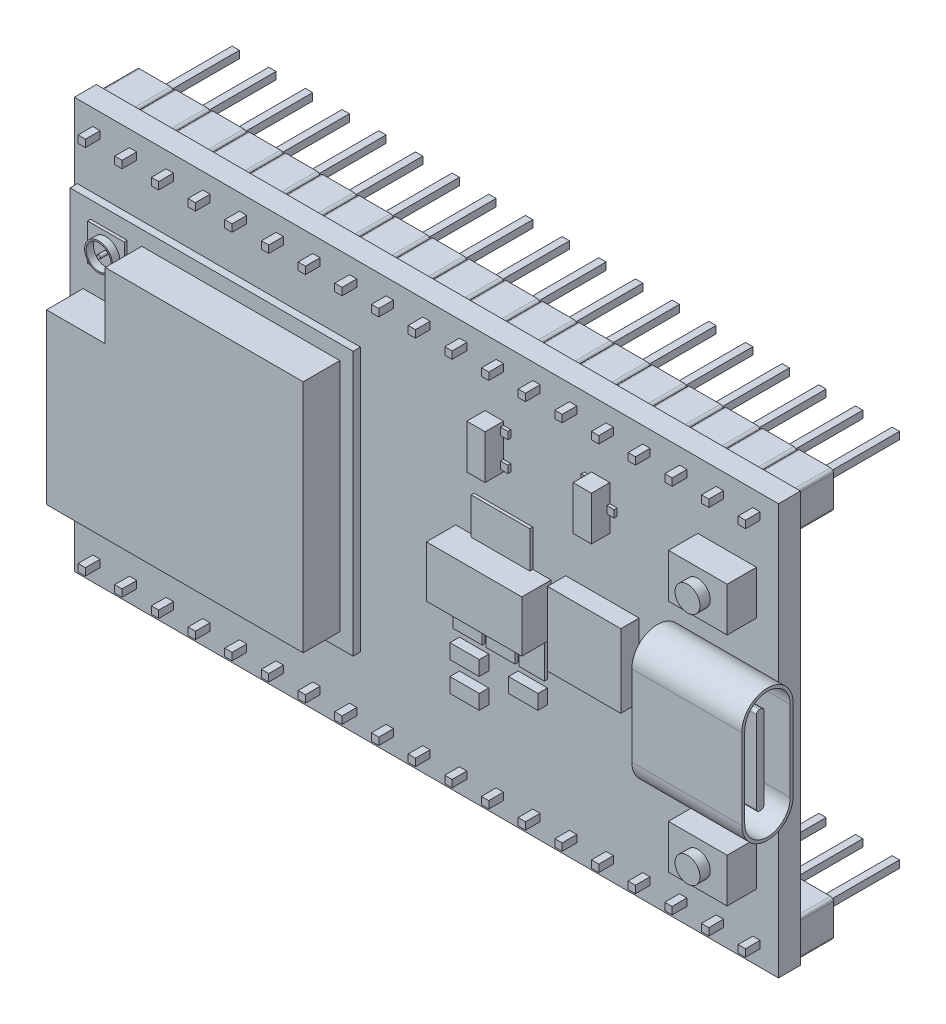
from build123d import *

# Parameters (mm, degrees)
SKETCH1_W                = 48
SKETCH1_H                = 28
BOSS_EXTRUDE1_DEPTH      = 1.5
BOSS_EXTRUDE2_DEPTH      = 2.5
BOSS_EXTRUDE3_DEPTH      = 5.5
BOSS_EXTRUDE3_DEPTH_BACK = 5
SKETCH3_W                = 0.5
SKETCH3_H                = 0.5
BOSS_EXTRUDE4_START      = -6
BOSS_EXTRUDE4_DEPTH      = 7
BOSS_EXTRUDE5_START      = 0.5
BOSS_EXTRUDE5_DEPTH      = 0.5
BOSS_EXTRUDE6_DEPTH      = 6.5
SKETCH7_W                = 19.3
SKETCH7_H                = 18
BOSS_EXTRUDE7_DEPTH      = 0.5
BOSS_EXTRUDE8_DEPTH      = 2.5
SKETCH9_W                = 2.5
SKETCH9_H                = 2.5
BOSS_EXTRUDE9_DEPTH      = 0.2
SKETCH10_R               = 0.95
SKETCH10_R_2             = 0.85
SKETCH10_R_3             = 0.125
BOSS_EXTRUDE10_DEPTH     = 0.5
SKETCH11_W               = 5
SKETCH11_H               = 5
SKETCH11_W_2             = 1.25
SKETCH11_H_2             = 3
BOSS_EXTRUDE11_DEPTH     = 1.25
SKETCH12_W               = 6.5
SKETCH12_H               = 3.5
BOSS_EXTRUDE12_DEPTH     = 2
SKETCH13_W               = 0.5
SKETCH13_H               = 0.5
SKETCH13_W_2             = 1.75
SKETCH13_H_2             = 2.5
SKETCH13_W_3             = 2
SKETCH13_W_4             = 4
BOSS_EXTRUDE13_DEPTH     = 0.2
SKETCH14_W               = 2
SKETCH14_H               = 1
BOSS_EXTRUDE14_DEPTH     = 0.65
SKETCH15_W               = 4
SKETCH15_H               = 3
BOSS_EXTRUDE15_DEPTH     = 2
SKETCH16_R               = 0.85
BOSS_EXTRUDE16_DEPTH     = 0.7


with BuildPart() as part:
    # Sketch1 → Boss-Extrude1 (new body)
    with BuildSketch(Plane.XY):
        Rectangle(SKETCH1_W, SKETCH1_H)
    extrude(amount=BOSS_EXTRUDE1_DEPTH)

    # Sketch2 → Boss-Extrude2 (add)
    with BuildSketch(Plane(origin=(0, 0, 0), x_dir=(-1, 0, 0), z_dir=(0, 0, -1))):
        with BuildLine():
            Line((-23.55, -13.9), (-21.45, -13.9))
            ThreePointArc((-21.45, -13.9), (-21.308578644, -13.841421356), (-21.25, -13.7))
            ThreePointArc((-21.25, -13.7), (-21.191421356, -13.841421356), (-21.05, -13.9))
            Line((-21.05, -13.9), (-18.95, -13.9))
            ThreePointArc((-18.95, -13.9), (-18.808578644, -13.841421356), (-18.75, -13.7))
            ThreePointArc((-18.75, -13.7), (-18.691421356, -13.841421356), (-18.55, -13.9))
            Line((-18.55, -13.9), (-16.45, -13.9))
            ThreePointArc((-16.45, -13.9), (-16.308578644, -13.841421356), (-16.25, -13.7))
            ThreePointArc((-16.25, -13.7), (-16.191421356, -13.841421356), (-16.05, -13.9))
            Line((-16.05, -13.9), (-13.95, -13.9))
            ThreePointArc((-13.95, -13.9), (-13.808578644, -13.841421356), (-13.75, -13.7))
            ThreePointArc((-13.75, -13.7), (-13.691421356, -13.841421356), (-13.55, -13.9))
            Line((-13.55, -13.9), (-11.45, -13.9))
            ThreePointArc((-11.45, -13.9), (-11.308578644, -13.841421356), (-11.25, -13.7))
            ThreePointArc((-11.25, -13.7), (-11.191421356, -13.841421356), (-11.05, -13.9))
            Line((-11.05, -13.9), (-8.95, -13.9))
            ThreePointArc((-8.95, -13.9), (-8.808578644, -13.841421356), (-8.75, -13.7))
            ThreePointArc((-8.75, -13.7), (-8.691421356, -13.841421356), (-8.55, -13.9))
            Line((-8.55, -13.9), (-6.45, -13.9))
            ThreePointArc((-6.45, -13.9), (-6.308578644, -13.841421356), (-6.25, -13.7))
            ThreePointArc((-6.25, -13.7), (-6.191421356, -13.841421356), (-6.05, -13.9))
            Line((-6.05, -13.9), (-3.95, -13.9))
            ThreePointArc((-3.95, -13.9), (-3.808578644, -13.841421356), (-3.75, -13.7))
            ThreePointArc((-3.75, -13.7), (-3.691421356, -13.841421356), (-3.55, -13.9))
            Line((-3.55, -13.9), (-1.45, -13.9))
            ThreePointArc((-1.45, -13.9), (-1.308578644, -13.841421356), (-1.25, -13.7))
            ThreePointArc((-1.25, -13.7), (-1.191421356, -13.841421356), (-1.05, -13.9))
            Line((-1.05, -13.9), (1.05, -13.9))
            ThreePointArc((1.05, -13.9), (1.191421356, -13.841421356), (1.25, -13.7))
            ThreePointArc((1.25, -13.7), (1.308578644, -13.841421356), (1.45, -13.9))
            Line((1.45, -13.9), (3.55, -13.9))
            ThreePointArc((3.55, -13.9), (3.691421356, -13.841421356), (3.75, -13.7))
            ThreePointArc((3.75, -13.7), (3.808578644, -13.841421356), (3.95, -13.9))
            Line((3.95, -13.9), (6.05, -13.9))
            ThreePointArc((6.05, -13.9), (6.191421356, -13.841421356), (6.25, -13.7))
            ThreePointArc((6.25, -13.7), (6.308578644, -13.841421356), (6.45, -13.9))
            Line((6.45, -13.9), (8.55, -13.9))
            ThreePointArc((8.55, -13.9), (8.691421356, -13.841421356), (8.75, -13.7))
            ThreePointArc((8.75, -13.7), (8.808578644, -13.841421356), (8.95, -13.9))
            Line((8.95, -13.9), (11.05, -13.9))
            ThreePointArc((11.05, -13.9), (11.191421356, -13.841421356), (11.25, -13.7))
            ThreePointArc((11.25, -13.7), (11.308578644, -13.841421356), (11.45, -13.9))
            Line((11.45, -13.9), (13.55, -13.9))
            ThreePointArc((13.55, -13.9), (13.691421356, -13.841421356), (13.75, -13.7))
            ThreePointArc((13.75, -13.7), (13.808578644, -13.841421356), (13.95, -13.9))
            Line((13.95, -13.9), (16.05, -13.9))
            ThreePointArc((16.05, -13.9), (16.191421356, -13.841421356), (16.25, -13.7))
            ThreePointArc((16.25, -13.7), (16.308578644, -13.841421356), (16.45, -13.9))
            Line((16.45, -13.9), (18.55, -13.9))
            ThreePointArc((18.55, -13.9), (18.691421356, -13.841421356), (18.75, -13.7))
            ThreePointArc((18.75, -13.7), (18.808578644, -13.841421356), (18.95, -13.9))
            Line((18.95, -13.9), (21.05, -13.9))
            ThreePointArc((21.05, -13.9), (21.191421356, -13.841421356), (21.25, -13.7))
            ThreePointArc((21.25, -13.7), (21.308578644, -13.841421356), (21.45, -13.9))
            Line((21.45, -13.9), (23.55, -13.9))
            ThreePointArc((23.55, -13.9), (23.691421356, -13.841421356), (23.75, -13.7))
            Line((23.75, -13.7), (23.75, -11.6))
            ThreePointArc((23.75, -11.6), (23.691421356, -11.458578644), (23.55, -11.4))
            Line((23.55, -11.4), (21.45, -11.4))
            ThreePointArc((21.45, -11.4), (21.308578644, -11.458578644), (21.25, -11.6))
            ThreePointArc((21.25, -11.6), (21.191421356, -11.458578644), (21.05, -11.4))
            Line((21.05, -11.4), (18.95, -11.4))
            ThreePointArc((18.95, -11.4), (18.808578644, -11.458578644), (18.75, -11.6))
            ThreePointArc((18.75, -11.6), (18.691421356, -11.458578644), (18.55, -11.4))
            Line((18.55, -11.4), (16.45, -11.4))
            ThreePointArc((16.45, -11.4), (16.308578644, -11.458578644), (16.25, -11.6))
            ThreePointArc((16.25, -11.6), (16.191421356, -11.458578644), (16.05, -11.4))
            Line((16.05, -11.4), (13.95, -11.4))
            ThreePointArc((13.95, -11.4), (13.808578644, -11.458578644), (13.75, -11.6))
            ThreePointArc((13.75, -11.6), (13.691421356, -11.458578644), (13.55, -11.4))
            Line((13.55, -11.4), (11.45, -11.4))
            ThreePointArc((11.45, -11.4), (11.308578644, -11.458578644), (11.25, -11.6))
            ThreePointArc((11.25, -11.6), (11.191421356, -11.458578644), (11.05, -11.4))
            Line((11.05, -11.4), (8.95, -11.4))
            ThreePointArc((8.95, -11.4), (8.808578644, -11.458578644), (8.75, -11.6))
            ThreePointArc((8.75, -11.6), (8.691421356, -11.458578644), (8.55, -11.4))
            Line((8.55, -11.4), (6.45, -11.4))
            ThreePointArc((6.45, -11.4), (6.308578644, -11.458578644), (6.25, -11.6))
            ThreePointArc((6.25, -11.6), (6.191421356, -11.458578644), (6.05, -11.4))
            Line((6.05, -11.4), (3.95, -11.4))
            ThreePointArc((3.95, -11.4), (3.808578644, -11.458578644), (3.75, -11.6))
            ThreePointArc((3.75, -11.6), (3.691421356, -11.458578644), (3.55, -11.4))
            Line((3.55, -11.4), (1.45, -11.4))
            ThreePointArc((1.45, -11.4), (1.308578644, -11.458578644), (1.25, -11.6))
            ThreePointArc((1.25, -11.6), (1.191421356, -11.458578644), (1.05, -11.4))
            Line((1.05, -11.4), (-1.05, -11.4))
            ThreePointArc((-1.05, -11.4), (-1.191421356, -11.458578644), (-1.25, -11.6))
            ThreePointArc((-1.25, -11.6), (-1.308578644, -11.458578644), (-1.45, -11.4))
            Line((-1.45, -11.4), (-3.55, -11.4))
            ThreePointArc((-3.55, -11.4), (-3.691421356, -11.458578644), (-3.75, -11.6))
            ThreePointArc((-3.75, -11.6), (-3.808578644, -11.458578644), (-3.95, -11.4))
            Line((-3.95, -11.4), (-6.05, -11.4))
            ThreePointArc((-6.05, -11.4), (-6.191421356, -11.458578644), (-6.25, -11.6))
            ThreePointArc((-6.25, -11.6), (-6.308578644, -11.458578644), (-6.45, -11.4))
            Line((-6.45, -11.4), (-8.55, -11.4))
            ThreePointArc((-8.55, -11.4), (-8.691421356, -11.458578644), (-8.75, -11.6))
            ThreePointArc((-8.75, -11.6), (-8.808578644, -11.458578644), (-8.95, -11.4))
            Line((-8.95, -11.4), (-11.05, -11.4))
            ThreePointArc((-11.05, -11.4), (-11.191421356, -11.458578644), (-11.25, -11.6))
            ThreePointArc((-11.25, -11.6), (-11.308578644, -11.458578644), (-11.45, -11.4))
            Line((-11.45, -11.4), (-13.55, -11.4))
            ThreePointArc((-13.55, -11.4), (-13.691421356, -11.458578644), (-13.75, -11.6))
            ThreePointArc((-13.75, -11.6), (-13.808578644, -11.458578644), (-13.95, -11.4))
            Line((-13.95, -11.4), (-16.05, -11.4))
            ThreePointArc((-16.05, -11.4), (-16.191421356, -11.458578644), (-16.25, -11.6))
            ThreePointArc((-16.25, -11.6), (-16.308578644, -11.458578644), (-16.45, -11.4))
            Line((-16.45, -11.4), (-18.55, -11.4))
            ThreePointArc((-18.55, -11.4), (-18.691421356, -11.458578644), (-18.75, -11.6))
            ThreePointArc((-18.75, -11.6), (-18.808578644, -11.458578644), (-18.95, -11.4))
            Line((-18.95, -11.4), (-21.05, -11.4))
            ThreePointArc((-21.05, -11.4), (-21.191421356, -11.458578644), (-21.25, -11.6))
            ThreePointArc((-21.25, -11.6), (-21.308578644, -11.458578644), (-21.45, -11.4))
            Line((-21.45, -11.4), (-23.55, -11.4))
            ThreePointArc((-23.55, -11.4), (-23.691421356, -11.458578644), (-23.75, -11.6))
            Line((-23.75, -11.6), (-23.75, -13.7))
            ThreePointArc((-23.75, -13.7), (-23.691421356, -13.841421356), (-23.55, -13.9))
        make_face()
        with BuildLine():
            Line((21.45, 11.4), (23.55, 11.4))
            ThreePointArc((23.55, 11.4), (23.691421356, 11.458578644), (23.75, 11.6))
            Line((23.75, 11.6), (23.75, 13.7))
            ThreePointArc((23.75, 13.7), (23.691421356, 13.841421356), (23.55, 13.9))
            Line((23.55, 13.9), (21.45, 13.9))
            ThreePointArc((21.45, 13.9), (21.308578644, 13.841421356), (21.25, 13.7))
            ThreePointArc((21.25, 13.7), (21.191421356, 13.841421356), (21.05, 13.9))
            Line((21.05, 13.9), (18.95, 13.9))
            ThreePointArc((18.95, 13.9), (18.808578644, 13.841421356), (18.75, 13.7))
            ThreePointArc((18.75, 13.7), (18.691421356, 13.841421356), (18.55, 13.9))
            Line((18.55, 13.9), (16.45, 13.9))
            ThreePointArc((16.45, 13.9), (16.308578644, 13.841421356), (16.25, 13.7))
            ThreePointArc((16.25, 13.7), (16.191421356, 13.841421356), (16.05, 13.9))
            Line((16.05, 13.9), (13.95, 13.9))
            ThreePointArc((13.95, 13.9), (13.808578644, 13.841421356), (13.75, 13.7))
            ThreePointArc((13.75, 13.7), (13.691421356, 13.841421356), (13.55, 13.9))
            Line((13.55, 13.9), (11.45, 13.9))
            ThreePointArc((11.45, 13.9), (11.308578644, 13.841421356), (11.25, 13.7))
            ThreePointArc((11.25, 13.7), (11.191421356, 13.841421356), (11.05, 13.9))
            Line((11.05, 13.9), (8.95, 13.9))
            ThreePointArc((8.95, 13.9), (8.808578644, 13.841421356), (8.75, 13.7))
            ThreePointArc((8.75, 13.7), (8.691421356, 13.841421356), (8.55, 13.9))
            Line((8.55, 13.9), (6.45, 13.9))
            ThreePointArc((6.45, 13.9), (6.308578644, 13.841421356), (6.25, 13.7))
            ThreePointArc((6.25, 13.7), (6.191421356, 13.841421356), (6.05, 13.9))
            Line((6.05, 13.9), (3.95, 13.9))
            ThreePointArc((3.95, 13.9), (3.808578644, 13.841421356), (3.75, 13.7))
            ThreePointArc((3.75, 13.7), (3.691421356, 13.841421356), (3.55, 13.9))
            Line((3.55, 13.9), (1.45, 13.9))
            ThreePointArc((1.45, 13.9), (1.308578644, 13.841421356), (1.25, 13.7))
            ThreePointArc((1.25, 13.7), (1.191421356, 13.841421356), (1.05, 13.9))
            Line((1.05, 13.9), (-1.05, 13.9))
            ThreePointArc((-1.05, 13.9), (-1.191421356, 13.841421356), (-1.25, 13.7))
            ThreePointArc((-1.25, 13.7), (-1.308578644, 13.841421356), (-1.45, 13.9))
            Line((-1.45, 13.9), (-3.55, 13.9))
            ThreePointArc((-3.55, 13.9), (-3.691421356, 13.841421356), (-3.75, 13.7))
            ThreePointArc((-3.75, 13.7), (-3.808578644, 13.841421356), (-3.95, 13.9))
            Line((-3.95, 13.9), (-6.05, 13.9))
            ThreePointArc((-6.05, 13.9), (-6.191421356, 13.841421356), (-6.25, 13.7))
            ThreePointArc((-6.25, 13.7), (-6.308578644, 13.841421356), (-6.45, 13.9))
            Line((-6.45, 13.9), (-8.55, 13.9))
            ThreePointArc((-8.55, 13.9), (-8.691421356, 13.841421356), (-8.75, 13.7))
            ThreePointArc((-8.75, 13.7), (-8.808578644, 13.841421356), (-8.95, 13.9))
            Line((-8.95, 13.9), (-11.05, 13.9))
            ThreePointArc((-11.05, 13.9), (-11.191421356, 13.841421356), (-11.25, 13.7))
            ThreePointArc((-11.25, 13.7), (-11.308578644, 13.841421356), (-11.45, 13.9))
            Line((-11.45, 13.9), (-13.55, 13.9))
            ThreePointArc((-13.55, 13.9), (-13.691421356, 13.841421356), (-13.75, 13.7))
            ThreePointArc((-13.75, 13.7), (-13.808578644, 13.841421356), (-13.95, 13.9))
            Line((-13.95, 13.9), (-16.05, 13.9))
            ThreePointArc((-16.05, 13.9), (-16.191421356, 13.841421356), (-16.25, 13.7))
            ThreePointArc((-16.25, 13.7), (-16.308578644, 13.841421356), (-16.45, 13.9))
            Line((-16.45, 13.9), (-18.55, 13.9))
            ThreePointArc((-18.55, 13.9), (-18.691421356, 13.841421356), (-18.75, 13.7))
            ThreePointArc((-18.75, 13.7), (-18.808578644, 13.841421356), (-18.95, 13.9))
            Line((-18.95, 13.9), (-21.05, 13.9))
            ThreePointArc((-21.05, 13.9), (-21.191421356, 13.841421356), (-21.25, 13.7))
            ThreePointArc((-21.25, 13.7), (-21.308578644, 13.841421356), (-21.45, 13.9))
            Line((-21.45, 13.9), (-23.55, 13.9))
            ThreePointArc((-23.55, 13.9), (-23.691421356, 13.841421356), (-23.75, 13.7))
            Line((-23.75, 13.7), (-23.75, 11.6))
            ThreePointArc((-23.75, 11.6), (-23.691421356, 11.458578644), (-23.55, 11.4))
            Line((-23.55, 11.4), (-21.45, 11.4))
            ThreePointArc((-21.45, 11.4), (-21.308578644, 11.458578644), (-21.25, 11.6))
            ThreePointArc((-21.25, 11.6), (-21.191421356, 11.458578644), (-21.05, 11.4))
            Line((-21.05, 11.4), (-18.95, 11.4))
            ThreePointArc((-18.95, 11.4), (-18.808578644, 11.458578644), (-18.75, 11.6))
            ThreePointArc((-18.75, 11.6), (-18.691421356, 11.458578644), (-18.55, 11.4))
            Line((-18.55, 11.4), (-16.45, 11.4))
            ThreePointArc((-16.45, 11.4), (-16.308578644, 11.458578644), (-16.25, 11.6))
            ThreePointArc((-16.25, 11.6), (-16.191421356, 11.458578644), (-16.05, 11.4))
            Line((-16.05, 11.4), (-13.95, 11.4))
            ThreePointArc((-13.95, 11.4), (-13.808578644, 11.458578644), (-13.75, 11.6))
            ThreePointArc((-13.75, 11.6), (-13.691421356, 11.458578644), (-13.55, 11.4))
            Line((-13.55, 11.4), (-11.45, 11.4))
            ThreePointArc((-11.45, 11.4), (-11.308578644, 11.458578644), (-11.25, 11.6))
            ThreePointArc((-11.25, 11.6), (-11.191421356, 11.458578644), (-11.05, 11.4))
            Line((-11.05, 11.4), (-8.95, 11.4))
            ThreePointArc((-8.95, 11.4), (-8.808578644, 11.458578644), (-8.75, 11.6))
            ThreePointArc((-8.75, 11.6), (-8.691421356, 11.458578644), (-8.55, 11.4))
            Line((-8.55, 11.4), (-6.45, 11.4))
            ThreePointArc((-6.45, 11.4), (-6.308578644, 11.458578644), (-6.25, 11.6))
            ThreePointArc((-6.25, 11.6), (-6.191421356, 11.458578644), (-6.05, 11.4))
            Line((-6.05, 11.4), (-3.95, 11.4))
            ThreePointArc((-3.95, 11.4), (-3.808578644, 11.458578644), (-3.75, 11.6))
            ThreePointArc((-3.75, 11.6), (-3.691421356, 11.458578644), (-3.55, 11.4))
            Line((-3.55, 11.4), (-1.45, 11.4))
            ThreePointArc((-1.45, 11.4), (-1.308578644, 11.458578644), (-1.25, 11.6))
            ThreePointArc((-1.25, 11.6), (-1.191421356, 11.458578644), (-1.05, 11.4))
            Line((-1.05, 11.4), (1.05, 11.4))
            ThreePointArc((1.05, 11.4), (1.191421356, 11.458578644), (1.25, 11.6))
            ThreePointArc((1.25, 11.6), (1.308578644, 11.458578644), (1.45, 11.4))
            Line((1.45, 11.4), (3.55, 11.4))
            ThreePointArc((3.55, 11.4), (3.691421356, 11.458578644), (3.75, 11.6))
            ThreePointArc((3.75, 11.6), (3.808578644, 11.458578644), (3.95, 11.4))
            Line((3.95, 11.4), (6.05, 11.4))
            ThreePointArc((6.05, 11.4), (6.191421356, 11.458578644), (6.25, 11.6))
            ThreePointArc((6.25, 11.6), (6.308578644, 11.458578644), (6.45, 11.4))
            Line((6.45, 11.4), (8.55, 11.4))
            ThreePointArc((8.55, 11.4), (8.691421356, 11.458578644), (8.75, 11.6))
            ThreePointArc((8.75, 11.6), (8.808578644, 11.458578644), (8.95, 11.4))
            Line((8.95, 11.4), (11.05, 11.4))
            ThreePointArc((11.05, 11.4), (11.191421356, 11.458578644), (11.25, 11.6))
            ThreePointArc((11.25, 11.6), (11.308578644, 11.458578644), (11.45, 11.4))
            Line((11.45, 11.4), (13.55, 11.4))
            ThreePointArc((13.55, 11.4), (13.691421356, 11.458578644), (13.75, 11.6))
            ThreePointArc((13.75, 11.6), (13.808578644, 11.458578644), (13.95, 11.4))
            Line((13.95, 11.4), (16.05, 11.4))
            ThreePointArc((16.05, 11.4), (16.191421356, 11.458578644), (16.25, 11.6))
            ThreePointArc((16.25, 11.6), (16.308578644, 11.458578644), (16.45, 11.4))
            Line((16.45, 11.4), (18.55, 11.4))
            ThreePointArc((18.55, 11.4), (18.691421356, 11.458578644), (18.75, 11.6))
            ThreePointArc((18.75, 11.6), (18.808578644, 11.458578644), (18.95, 11.4))
            Line((18.95, 11.4), (21.05, 11.4))
            ThreePointArc((21.05, 11.4), (21.191421356, 11.458578644), (21.25, 11.6))
            ThreePointArc((21.25, 11.6), (21.308578644, 11.458578644), (21.45, 11.4))
        make_face()
    extrude(amount=BOSS_EXTRUDE2_DEPTH)

    # Sketch3 → Boss-Extrude3 (add, two sides: drawn at the far end of the back side and taken through both)
    with BuildSketch(Plane(origin=(0, 0, -2.5), x_dir=(-1, 0, 0), z_dir=(0, 0, -1)).offset(-BOSS_EXTRUDE3_DEPTH_BACK)):
        with Locations((-22.5, -12.65)):
            Rectangle(SKETCH3_W, SKETCH3_H)
        with Locations((-20, -12.65)):
            Rectangle(SKETCH3_W, SKETCH3_H)
        with Locations((-17.5, -12.65)):
            Rectangle(SKETCH3_W, SKETCH3_H)
        with Locations((-15, -12.65)):
            Rectangle(SKETCH3_W, SKETCH3_H)
        with Locations((-12.5, -12.65)):
            Rectangle(SKETCH3_W, SKETCH3_H)
        with Locations((-10, -12.65)):
            Rectangle(SKETCH3_W, SKETCH3_H)
        with Locations((-7.5, -12.65)):
            Rectangle(SKETCH3_W, SKETCH3_H)
        with Locations((-5, -12.65)):
            Rectangle(SKETCH3_W, SKETCH3_H)
        with Locations((-2.5, -12.65)):
            Rectangle(SKETCH3_W, SKETCH3_H)
        with Locations((0, -12.65)):
            Rectangle(SKETCH3_W, SKETCH3_H)
        with Locations((2.5, -12.65)):
            Rectangle(SKETCH3_W, SKETCH3_H)
        with Locations((5, -12.65)):
            Rectangle(SKETCH3_W, SKETCH3_H)
        with Locations((7.5, -12.65)):
            Rectangle(SKETCH3_W, SKETCH3_H)
        with Locations((10, -12.65)):
            Rectangle(SKETCH3_W, SKETCH3_H)
        with Locations((12.5, -12.65)):
            Rectangle(SKETCH3_W, SKETCH3_H)
        with Locations((15, -12.65)):
            Rectangle(SKETCH3_W, SKETCH3_H)
        with Locations((17.5, -12.65)):
            Rectangle(SKETCH3_W, SKETCH3_H)
        with Locations((20, -12.65)):
            Rectangle(SKETCH3_W, SKETCH3_H)
        with Locations((22.5, -12.65)):
            Rectangle(SKETCH3_W, SKETCH3_H)
        with Locations((22.5, 12.65)):
            Rectangle(SKETCH3_W, SKETCH3_H)
        with Locations((20, 12.65)):
            Rectangle(SKETCH3_W, SKETCH3_H)
        with Locations((17.5, 12.65)):
            Rectangle(SKETCH3_W, SKETCH3_H)
        with Locations((15, 12.65)):
            Rectangle(SKETCH3_W, SKETCH3_H)
        with Locations((12.5, 12.65)):
            Rectangle(SKETCH3_W, SKETCH3_H)
        with Locations((10, 12.65)):
            Rectangle(SKETCH3_W, SKETCH3_H)
        with Locations((7.5, 12.65)):
            Rectangle(SKETCH3_W, SKETCH3_H)
        with Locations((5, 12.65)):
            Rectangle(SKETCH3_W, SKETCH3_H)
        with Locations((2.5, 12.65)):
            Rectangle(SKETCH3_W, SKETCH3_H)
        with Locations((0, 12.65)):
            Rectangle(SKETCH3_W, SKETCH3_H)
        with Locations((-2.5, 12.65)):
            Rectangle(SKETCH3_W, SKETCH3_H)
        with Locations((-5, 12.65)):
            Rectangle(SKETCH3_W, SKETCH3_H)
        with Locations((-7.5, 12.65)):
            Rectangle(SKETCH3_W, SKETCH3_H)
        with Locations((-10, 12.65)):
            Rectangle(SKETCH3_W, SKETCH3_H)
        with Locations((-12.5, 12.65)):
            Rectangle(SKETCH3_W, SKETCH3_H)
        with Locations((-15, 12.65)):
            Rectangle(SKETCH3_W, SKETCH3_H)
        with Locations((-17.5, 12.65)):
            Rectangle(SKETCH3_W, SKETCH3_H)
        with Locations((-20, 12.65)):
            Rectangle(SKETCH3_W, SKETCH3_H)
        with Locations((-22.5, 12.65)):
            Rectangle(SKETCH3_W, SKETCH3_H)
    extrude(amount=BOSS_EXTRUDE3_DEPTH + BOSS_EXTRUDE3_DEPTH_BACK)

    # Sketch4 → Boss-Extrude4 (add)
    with BuildSketch(Plane(origin=(24, 0, 0), x_dir=(0, 0, -1), z_dir=(1, 0, 0)).offset(BOSS_EXTRUDE4_START)):
        with BuildLine():
            Line((-5, -2.75), (-5, 2.75))
            ThreePointArc((-5, 2.75), (-3.25, 4.5), (-1.5, 2.75))
            Line((-1.5, 2.75), (-1.5, -2.75))
            ThreePointArc((-1.5, -2.75), (-3.25, -4.5), (-5, -2.75))
        make_face()
        with BuildLine():
            Line((-4.8, -2.75), (-4.8, 2.75))
            ThreePointArc((-4.8, 2.75), (-3.25, 4.3), (-1.7, 2.75))
            Line((-1.7, 2.75), (-1.7, -2.75))
            ThreePointArc((-1.7, -2.75), (-3.25, -4.3), (-4.8, -2.75))
        make_face(mode=Mode.SUBTRACT)
    extrude(amount=BOSS_EXTRUDE4_DEPTH)

    # Sketch5 → Boss-Extrude5 (add)
    with BuildSketch(Plane.ZY.offset(-18).offset(BOSS_EXTRUDE5_START)):
        with BuildLine():
            Line((5, -2.75), (5, 2.75))
            ThreePointArc((5, 2.75), (3.25, 4.5), (1.5, 2.75))
            Line((1.5, 2.75), (1.5, -2.75))
            ThreePointArc((1.5, -2.75), (3.25, -4.5), (5, -2.75))
        make_face()
    extrude(amount=-BOSS_EXTRUDE5_DEPTH)

    # Sketch6 → Boss-Extrude6 (add)
    with BuildSketch(Plane(origin=(18, 0, 0), x_dir=(0, 0, -1), z_dir=(1, 0, 0))):
        with BuildLine():
            Line((-3.3, -3), (-3.2, -3))
            ThreePointArc((-3.2, -3), (-3.058578644, -2.941421356), (-3, -2.8))
            Line((-3, -2.8), (-3, 2.8))
            ThreePointArc((-3, 2.8), (-3.058578644, 2.941421356), (-3.2, 3))
            Line((-3.2, 3), (-3.3, 3))
            ThreePointArc((-3.3, 3), (-3.441421356, 2.941421356), (-3.5, 2.8))
            Line((-3.5, 2.8), (-3.5, -2.8))
            ThreePointArc((-3.5, -2.8), (-3.441421356, -2.941421356), (-3.3, -3))
        make_face()
    extrude(amount=BOSS_EXTRUDE6_DEPTH)

    # Sketch7 → Boss-Extrude7 (add)
    with BuildSketch(Plane.XY.offset(1.5)):
        with Locations((-14.15, 0)):
            Rectangle(SKETCH7_W, SKETCH7_H)
    extrude(amount=BOSS_EXTRUDE7_DEPTH)

    # Sketch8 → Boss-Extrude8 (add)
    with BuildSketch(Plane.XY.offset(2)):
        Polygon((-22.9, 3.5), (-22.9, -8), (-5.4, -8), (-5.4, 8), (-18.9, 8), (-18.9, 3.5), align=None)
    extrude(amount=BOSS_EXTRUDE8_DEPTH)

    # Sketch9 → Boss-Extrude9 (add)
    with BuildSketch(Plane.XY.offset(2)):
        with Locations((-21.15, 6.6)):
            Rectangle(SKETCH9_W, SKETCH9_H)
    extrude(amount=BOSS_EXTRUDE9_DEPTH)

    # Sketch10 → Boss-Extrude10 (add)
    # profile 1 of 2: a face of its own
    with BuildSketch(Plane.XY.offset(2.2)):
        with Locations((-21.15, 6.6)):
            Circle(SKETCH10_R)
        with Locations((-21.15, 6.6)):
            Circle(SKETCH10_R_2, mode=Mode.SUBTRACT)
    # profile 2 of 2: a face of its own
    with BuildSketch(Plane.XY.offset(2.2)):
        with Locations((-21.15, 6.6)):
            Circle(SKETCH10_R_3)
    extrude(amount=BOSS_EXTRUDE10_DEPTH)

    # Sketch11 → Boss-Extrude11 (add)
    with BuildSketch(Plane.XY.offset(1.5)):
        with Locations((12, 0)):
            Rectangle(SKETCH11_W, SKETCH11_H)
        with Locations((11.875, 8)):
            Rectangle(SKETCH11_W_2, SKETCH11_H_2)
        with Locations((4.625, 8)):
            Rectangle(SKETCH11_W_2, SKETCH11_H_2)
    extrude(amount=BOSS_EXTRUDE11_DEPTH)

    # Sketch12 → Boss-Extrude12 (add)
    with BuildSketch(Plane.XY.offset(1.5)):
        with Locations((5.25, 0)):
            Rectangle(SKETCH12_W, SKETCH12_H)
    extrude(amount=BOSS_EXTRUDE12_DEPTH)

    # Sketch13 → Boss-Extrude13 (add)
    with BuildSketch(Plane.XY.offset(1.5)):
        with Locations((3.75, 8)):
            Rectangle(SKETCH13_W, SKETCH13_H)
        with Locations((5.5, 9)):
            Rectangle(SKETCH13_W, SKETCH13_H)
        with Locations((5.5, 7)):
            Rectangle(SKETCH13_W, SKETCH13_H)
        with Locations((7.375, -3)):
            Rectangle(SKETCH13_W_2, SKETCH13_H_2)
        with Locations((11, 7)):
            Rectangle(SKETCH13_W, SKETCH13_H)
        with Locations((11, 9)):
            Rectangle(SKETCH13_W, SKETCH13_H)
        with Locations((12.75, 8)):
            Rectangle(SKETCH13_W, SKETCH13_H)
        with Locations((3, -3)):
            Rectangle(SKETCH13_W_3, SKETCH13_H_2)
        with Locations((5.25, -3)):
            Rectangle(SKETCH13_W_3, SKETCH13_H_2)
        with Locations((5.25, 3)):
            Rectangle(SKETCH13_W_4, SKETCH13_H_2)
    extrude(amount=BOSS_EXTRUDE13_DEPTH)

    # Sketch14 → Boss-Extrude14 (add)
    with BuildSketch(Plane.XY.offset(1.5)):
        with Locations((3.25, -5.25)):
            Rectangle(SKETCH14_W, SKETCH14_H)
        with Locations((7.25, -5.25)):
            Rectangle(SKETCH14_W, SKETCH14_H)
        with Locations((3.25, -7.25)):
            Rectangle(SKETCH14_W, SKETCH14_H)
    extrude(amount=BOSS_EXTRUDE14_DEPTH)

    # Sketch15 → Boss-Extrude15 (add)
    with BuildSketch(Plane.XY.offset(1.5)):
        with Locations((20.5, 8)):
            Rectangle(SKETCH15_W, SKETCH15_H)
        with Locations((20.5, -8)):
            Rectangle(SKETCH15_W, SKETCH15_H)
    extrude(amount=BOSS_EXTRUDE15_DEPTH)

    # Sketch16 → Boss-Extrude16 (add)
    with BuildSketch(Plane.XY.offset(3.5)):
        with Locations((20.5, 8)):
            Circle(SKETCH16_R)
        with Locations((20.5, -8)):
            Circle(SKETCH16_R)
    extrude(amount=BOSS_EXTRUDE16_DEPTH)


solid = part.part
